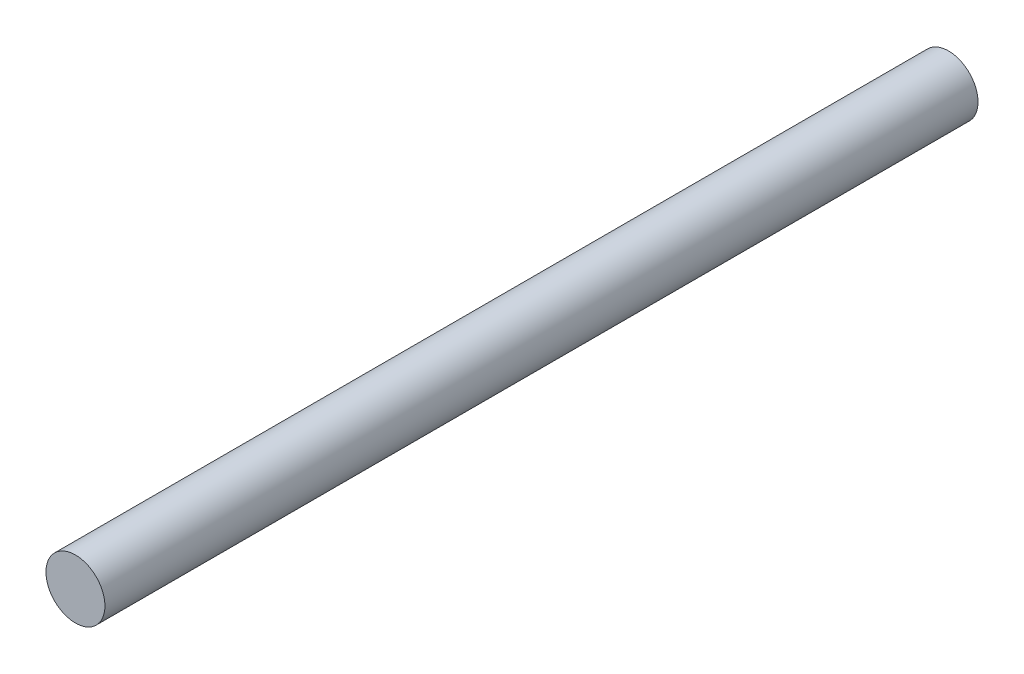
from build123d import *

# Parameters (mm, degrees)
SKETCH2_R           = 6.35
BOSS_EXTRUDE1_DEPTH = 187.96


with BuildPart() as part:
    # Sketch2 → Boss-Extrude1 (new body)
    with BuildSketch(Plane.XY):
        Circle(SKETCH2_R)
    extrude(amount=BOSS_EXTRUDE1_DEPTH)


solid = part.part
